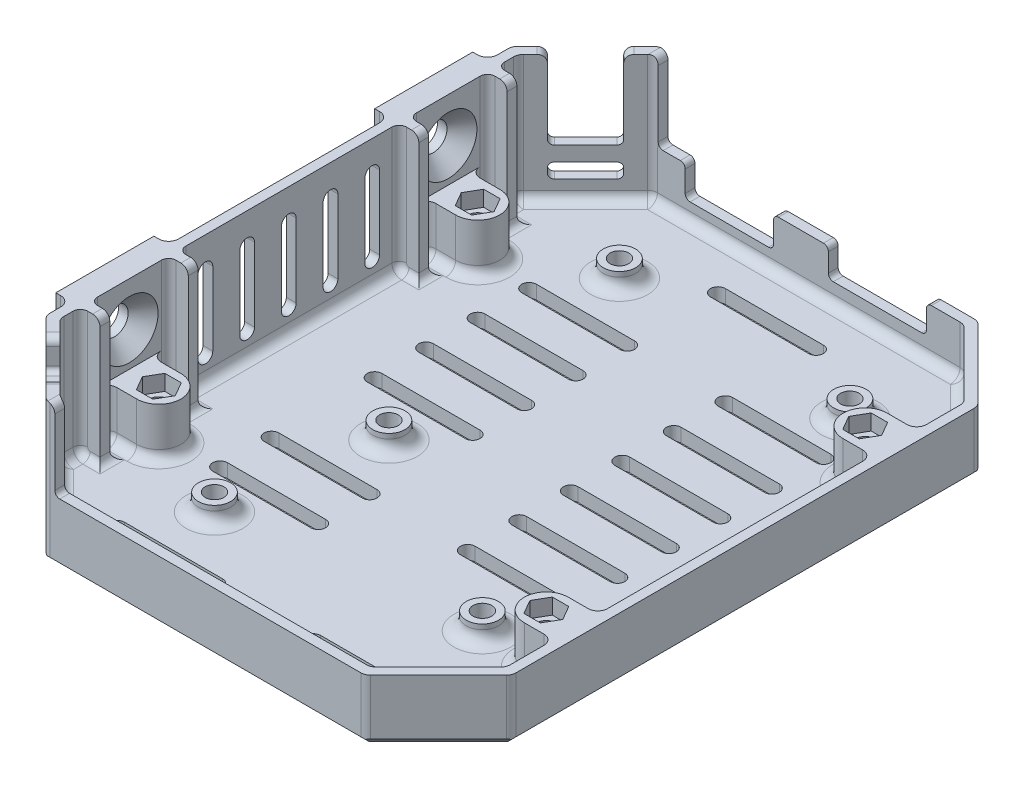
from build123d import *

# Parameters (mm, degrees)
SKICA1_W                                  = 95
SKICA1_H                                  = 125
P_IDAT_VYSUNUT_M1_DEPTH                   = 2.8
ZKOSEN_1_SIZE                             = 15
P_IDAT_VYSUNUT_M2_DEPTH                   = 10
SKICA3_R                                  = 1.9
ODEBRAT_VYSUNUT_M1_DEPTH                  = 10
ZKOSEN_2_SIZE                             = 1.5
ZAOBLIT1_R                                = 2
P_IDAT_START                              = 3.5
SKICA5_R                                  = 3.3
SKICA5_R_2                                = 1.9
P_IDAT_VYSUNUT_M3_DEPTH                   = 3.5
ZAOBLIT2_R                                = 2.5
ODEBRAT_VYSUNUT_M2_DEPTH                  = 2.8
SKICA7_W                                  = 23.5
SKICA7_H                                  = 20
SKICA7_R                                  = 3
P_IDAT_VYSUNUT_M4_DEPTH                   = 4.4
P_IDAT_VYSUNUT_M5_DEPTH                   = 16
SKICA9_W                                  = 24
SKICA9_H                                  = 20
SKICA9_R                                  = 3
P_IDAT_VYSUNUT_M6_DEPTH                   = 4
P_IDAT_VYSUNUT_M7_REACH                   = 161.623
SKICA10_W                                 = 6
SKICA10_H                                 = 2
ZAOBLIT4_R                                = 1.5
SKICA11_W                                 = 20
SKICA11_H                                 = 5.8
SKICA11_W_2                               = 18
SKICA11_H_2                               = 6.3
ODEBRAT_VYSUNUT_M3_DEPTH                  = 10
ZAOBLIT5_R                                = 1
ODEBRAT_VYSUNUT_M4_DEPTH                  = 10
ODEBRAT_VYSUNUT_M5_DEPTH                  = 3.5
SKICA14_W                                 = 11
SKICA14_H                                 = 32
SKICA14_H_2                               = 3
ODEBRAT_VYSUNUT_M6_DEPTH                  = 3.5
SKICA15_W                                 = 10
SKICA15_H                                 = 12
SKICA15_H_2                               = 3
ODEBRAT_VYSUNUT_M7_DEPTH                  = 3.5
ZAOBLIT6_R                                = 1
ZAOBLIT8_R                                = 1.5
ZAOBLIT9_R                                = 2
P_IDAT_VYSUNUT_M10_DEPTH                  = 10
ODEBRAT_VYSUNUT_M8_DEPTH                  = 3.2
SKICA25_W                                 = 20
SKICA25_H                                 = 20.4
P_IDAT_VYSUNUT_M13_DEPTH                  = 3
ZAOBLIT7_R                                = 2
ZAOBLIT13_R                               = 1
SKICA27_R                                 = 1.9
ODEBRAT_VYSUNUT_M11_DEPTH                 = 16
ZAOBLIT14_R                               = 2
ODEBRAT_VYSUNUT_M12_DEPTH                 = 101
KU_ELOV_ZAHLOUBEN_PRO_M5_ROUBY_SE_2_COUNT = 2
KU_ELOV_ZAHLOUBEN_PRO_M5_ROUBY_SE_2_PITCH = 65


# Some blends are built 0.0001 mm under size
with BuildPart() as part:
    # Skica1 → Přidat vysunutím1 (new body)
    with BuildSketch(Plane(origin=(0, 0, 0), x_dir=(1, 0, 0), z_dir=(0, 1, 0))):
        with Locations((47.5, 62.5)):
            Rectangle(SKICA1_W, SKICA1_H)
    extrude(amount=P_IDAT_VYSUNUT_M1_DEPTH)

    # Zkosení1
    zkosen_1_edges = [part.edges().sort_by_distance(p)[0] for p in [
        (0, 1.4, -125),
        (95, 1.4, -125),
        (95, 1.4, 0),
        (0, 1.4, 0),
    ]]
    chamfer(zkosen_1_edges, length=ZKOSEN_1_SIZE)

    # Skica2 → Přidat vysunutím2 (add)
    with BuildSketch(Plane(origin=(0, 2.8, 0), x_dir=(1, 0, 0), z_dir=(0, 1, 0))):
        Polygon((95, 15), (95, 110), (80, 125), (15, 125), (0, 110), (0, 15), (15, 0), (80, 0), align=None)
        Polygon((93, 15.828427125), (93, 109.171572875), (79.171572875, 123), (15.828427125, 123), (2, 109.171572875), (2, 15.828427125), (15.828427125, 2), (79.171572875, 2), align=None, mode=Mode.SUBTRACT)
    extrude(amount=P_IDAT_VYSUNUT_M2_DEPTH)

    # Skica3 → Odebrat vysunutím1 (cut)
    with BuildSketch(Plane(origin=(0, 2.8, 0), x_dir=(1, 0, 0), z_dir=(0, 1, 0))):
        with Locations(Location((25.87, 106.03, 0), (0, 0, 270))):
            Circle(SKICA3_R)
        with Locations(Location((74.13, 104.76, 0), (0, 0, 270))):
            Circle(SKICA3_R)
        with Locations(Location((74.13, 29.83, 0), (0, 0, 270))):
            Circle(SKICA3_R)
        with Locations(Location((30.95, 53.96, 0), (0, 0, 270))):
            Circle(SKICA3_R)
        with Locations(Location((25.87, 23.48, 0), (0, 0, 270))):
            Circle(SKICA3_R)
    extrude(amount=-ODEBRAT_VYSUNUT_M1_DEPTH, mode=Mode.SUBTRACT)

    # Zkosení2
    zkosen_2_edges = [part.edges().sort_by_distance(p)[0] for p in [
        (47.5, 0, -125),
        (0, 0, -62.5),
        (95, 0, -62.5),
        (47.5, 0, 0),
        (7.5, 0, -117.5),
        (7.5, 0, -7.5),
        (87.5, 0, -7.5),
        (87.5, 0, -117.5),
    ]]
    chamfer(zkosen_2_edges, length=ZKOSEN_2_SIZE)

    # Zaoblit1
    zaoblit1_edges = [part.edges().sort_by_distance(p)[0] for p in [
        (95, 7.15, -110),
        (80, 7.15, 0),
        (0, 7.15, -15),
        (15, 7.15, -125),
        (80, 7.15, -125),
        (95, 7.15, -15),
        (15, 7.15, 0),
        (0, 7.15, -110),
        (86.085786438, 2.8, -8.914213562),
        (93, 2.8, -62.5),
        (86.085786438, 2.8, -116.085786438),
        (47.5, 2.8, -123),
        (8.914213562, 2.8, -116.085786438),
        (2, 2.8, -62.5),
        (8.914213562, 2.8, -8.914213562),
        (47.5, 2.8, -2),
        (93, 7.8, -15.828427125),
        (93, 7.8, -109.171572875),
        (79.171572875, 7.8, -123),
        (15.828427125, 7.8, -123),
        (2, 7.8, -109.171572875),
        (2, 7.8, -15.828427125),
        (15.828427125, 7.8, -2),
        (79.171572875, 7.8, -2),
    ]]
    fillet(zaoblit1_edges, radius=ZAOBLIT1_R)

    # Skica5 → Přidat vysunutím3 (add)
    # profile 1 of 5: a face of its own
    with BuildSketch(Plane(origin=(0, 2.8, 0), x_dir=(1, 0, 0), z_dir=(0, 1, 0)).offset(P_IDAT_START)):
        with Locations(Location((74.13, 29.83, 0), (0, 0, 90))):
            Circle(SKICA5_R)
        with Locations(Location((74.13, 29.83, 0), (0, 0, 270))):
            Circle(SKICA5_R_2, mode=Mode.SUBTRACT)
    # profile 2 of 5: a face of its own
    with BuildSketch(Plane(origin=(0, 2.8, 0), x_dir=(1, 0, 0), z_dir=(0, 1, 0)).offset(P_IDAT_START)):
        with Locations(Location((25.87, 23.48, 0), (0, 0, 90))):
            Circle(SKICA5_R)
        with Locations(Location((25.87, 23.48, 0), (0, 0, 270))):
            Circle(SKICA5_R_2, mode=Mode.SUBTRACT)
    # profile 3 of 5: a face of its own
    with BuildSketch(Plane(origin=(0, 2.8, 0), x_dir=(1, 0, 0), z_dir=(0, 1, 0)).offset(P_IDAT_START)):
        with Locations(Location((30.95, 53.96, 0), (0, 0, 90))):
            Circle(SKICA5_R)
        with Locations(Location((30.95, 53.96, 0), (0, 0, 270))):
            Circle(SKICA5_R_2, mode=Mode.SUBTRACT)
    # profile 4 of 5: a face of its own
    with BuildSketch(Plane(origin=(0, 2.8, 0), x_dir=(1, 0, 0), z_dir=(0, 1, 0)).offset(P_IDAT_START)):
        with Locations(Location((25.87, 106.03, 0), (0, 0, 90))):
            Circle(SKICA5_R)
        with Locations(Location((25.87, 106.03, 0), (0, 0, 270))):
            Circle(SKICA5_R_2, mode=Mode.SUBTRACT)
    # profile 5 of 5: a face of its own
    with BuildSketch(Plane(origin=(0, 2.8, 0), x_dir=(1, 0, 0), z_dir=(0, 1, 0)).offset(P_IDAT_START)):
        with Locations(Location((74.13, 104.76, 0), (0, 0, 90))):
            Circle(SKICA5_R)
        with Locations(Location((74.13, 104.76, 0), (0, 0, 270))):
            Circle(SKICA5_R_2, mode=Mode.SUBTRACT)
    extrude(amount=-P_IDAT_VYSUNUT_M3_DEPTH)

    # Zaoblit2
    zaoblit2_edges = [part.edges().sort_by_distance(p)[0] for p in [
        (74.13, 2.8, -26.53),
        (25.87, 2.8, -20.18),
        (30.95, 2.8, -50.66),
        (25.87, 2.8, -102.73),
        (74.13, 2.8, -101.46),
    ]]
    fillet(zaoblit2_edges, radius=ZAOBLIT2_R)

    # Skica6 → Odebrat vysunutím2 (cut)
    with BuildSketch(Plane.XZ):
        Polygon((75.862050808, -107.76), (77.594101615, -104.76), (75.862050808, -101.76), (72.397949192, -101.76), (70.665898385, -104.76), (72.397949192, -107.76), align=None)
        Polygon((27.602050808, -109.03), (29.334101615, -106.03), (27.602050808, -103.03), (24.137949192, -103.03), (22.405898385, -106.03), (24.137949192, -109.03), align=None)
        Polygon((32.682050808, -56.96), (34.414101615, -53.96), (32.682050808, -50.96), (29.217949192, -50.96), (27.485898385, -53.96), (29.217949192, -56.96), align=None)
        Polygon((27.602050808, -26.48), (29.334101615, -23.48), (27.602050808, -20.48), (24.137949192, -20.48), (22.405898385, -23.48), (24.137949192, -26.48), align=None)
        Polygon((75.862050808, -32.83), (77.594101615, -29.83), (75.862050808, -26.83), (72.397949192, -26.83), (70.665898385, -29.83), (72.397949192, -32.83), align=None)
    extrude(amount=-ODEBRAT_VYSUNUT_M2_DEPTH, mode=Mode.SUBTRACT)

    # Skica7 → Přidat vysunutím4 (add)
    # profile 1 of 2: a face of its own
    with BuildSketch(Plane(origin=(0, 0, 0), x_dir=(-1, 0, 0), z_dir=(0, -1, 0))):
        with Locations((10.25, 95)):
            Rectangle(SKICA7_W, SKICA7_H)
        with Locations(Location((12, 95, 0), (0, 0, 90))):
            Circle(SKICA7_R, mode=Mode.SUBTRACT)
    # profile 2 of 2: a face of its own
    with BuildSketch(Plane(origin=(0, 0, 0), x_dir=(-1, 0, 0), z_dir=(0, -1, 0))):
        with Locations((10.25, 30)):
            Rectangle(SKICA7_W, SKICA7_H)
        with Locations(Location((12, 30, 0), (0, 0, 270))):
            Circle(SKICA7_R, mode=Mode.SUBTRACT)
    extrude(amount=-P_IDAT_VYSUNUT_M4_DEPTH)

    # Skica8 → Přidat vysunutím5 (add)
    with BuildSketch(Plane(origin=(0, 12.8, 0), x_dir=(1, 0, 0), z_dir=(0, 1, 0))):
        with BuildLine():
            Line((2, 108.343145751), (2, 16.656854249))
            ThreePointArc((2, 16.656854249), (2.152240935, 15.891487385), (2.585786438, 15.242640687))
            Line((2.585786438, 15.242640687), (15.242640687, 2.585786438))
            ThreePointArc((15.242640687, 2.585786438), (15.958145414, 2.126018687), (16.8, 2.005129254))
            Line((16.8, 2.005129254), (16.8, 0))
            Line((16.8, 0), (15.828427125, 0))
            ThreePointArc((15.828427125, 0), (15.06306026, 0.152240935), (14.414213562, 0.585786438))
            Line((14.414213562, 0.585786438), (0.585786438, 14.414213562))
            ThreePointArc((0.585786438, 14.414213562), (0.152240935, 15.06306026), (0, 15.828427125))
            Line((0, 15.828427125), (0, 109.171572875))
            ThreePointArc((0, 109.171572875), (0.152240935, 109.93693974), (0.585786438, 110.585786438))
            Line((0.585786438, 110.585786438), (14.414213562, 124.414213562))
            ThreePointArc((14.414213562, 124.414213562), (15.06306026, 124.847759065), (15.828427125, 125))
            Line((15.828427125, 125), (16.8, 125))
            Line((16.8, 125), (16.8, 123))
            Line((16.8, 123), (16.8, 122.994870746))
            ThreePointArc((16.8, 122.994870746), (15.958145414, 122.873981313), (15.242640687, 122.414213562))
            Line((15.242640687, 122.414213562), (2.585786438, 109.757359313))
            ThreePointArc((2.585786438, 109.757359313), (2.152240935, 109.108512615), (2, 108.343145751))
        make_face()
    extrude(amount=P_IDAT_VYSUNUT_M5_DEPTH)

    # Skica9 → Přidat vysunutím6 (add)
    # profile 1 of 2: a face of its own
    with BuildSketch(Plane(origin=(0, 24.8, 0), x_dir=(1, 0, 0), z_dir=(0, 1, 0))):
        with Locations((-10, 95)):
            Rectangle(SKICA9_W, SKICA9_H)
        with Locations(Location((-12, 95, 0), (0, 0, 90))):
            Circle(SKICA9_R, mode=Mode.SUBTRACT)
    # profile 2 of 2: a face of its own
    with BuildSketch(Plane(origin=(0, 24.8, 0), x_dir=(1, 0, 0), z_dir=(0, 1, 0))):
        with Locations((-10, 30)):
            Rectangle(SKICA9_W, SKICA9_H)
        with Locations(Location((-12, 30, 0), (0, 0, 270))):
            Circle(SKICA9_R, mode=Mode.SUBTRACT)
    extrude(amount=P_IDAT_VYSUNUT_M6_DEPTH)

    # Přidat vysunutím7: up to this face of the body (flat: up to its plane)
    p_idat_vysunut_m7_end = Plane(part.part.faces().sort_by_distance((47.574191913, 2.8, -62.437021826))[0])
    # Skica10 → Přidat vysunutím7 (add, up to the picked face)
    with BuildSketch(Plane(origin=(0, 28.8, 0), x_dir=(1, 0, 0), z_dir=(0, 1, 0)), mode=Mode.PRIVATE) as p_idat_vysunut_m7_sk1:
        with Locations((3, 104)):
            Rectangle(SKICA10_W, SKICA10_H)
    p_idat_vysunut_m7_tool1 = split(extrude(p_idat_vysunut_m7_sk1.sketch, amount=-P_IDAT_VYSUNUT_M7_REACH, mode=Mode.PRIVATE), bisect_by=p_idat_vysunut_m7_end, keep=Keep.BOTH, mode=Mode.PRIVATE)
    # Skica10 → Přidat vysunutím7 (add, up to the picked face)
    with BuildSketch(Plane(origin=(0, 28.8, 0), x_dir=(1, 0, 0), z_dir=(0, 1, 0)), mode=Mode.PRIVATE) as p_idat_vysunut_m7_sk2:
        with Locations((3, 86)):
            Rectangle(SKICA10_W, SKICA10_H)
    p_idat_vysunut_m7_tool2 = split(extrude(p_idat_vysunut_m7_sk2.sketch, amount=-P_IDAT_VYSUNUT_M7_REACH, mode=Mode.PRIVATE), bisect_by=p_idat_vysunut_m7_end, keep=Keep.BOTH, mode=Mode.PRIVATE)
    # Skica10 → Přidat vysunutím7 (add, up to the picked face)
    with BuildSketch(Plane(origin=(0, 28.8, 0), x_dir=(1, 0, 0), z_dir=(0, 1, 0)), mode=Mode.PRIVATE) as p_idat_vysunut_m7_sk3:
        with Locations((3, 39)):
            Rectangle(SKICA10_W, SKICA10_H)
    p_idat_vysunut_m7_tool3 = split(extrude(p_idat_vysunut_m7_sk3.sketch, amount=-P_IDAT_VYSUNUT_M7_REACH, mode=Mode.PRIVATE), bisect_by=p_idat_vysunut_m7_end, keep=Keep.BOTH, mode=Mode.PRIVATE)
    # Skica10 → Přidat vysunutím7 (add, up to the picked face)
    with BuildSketch(Plane(origin=(0, 28.8, 0), x_dir=(1, 0, 0), z_dir=(0, 1, 0)), mode=Mode.PRIVATE) as p_idat_vysunut_m7_sk4:
        with Locations((3, 21)):
            Rectangle(SKICA10_W, SKICA10_H)
    p_idat_vysunut_m7_tool4 = split(extrude(p_idat_vysunut_m7_sk4.sketch, amount=-P_IDAT_VYSUNUT_M7_REACH, mode=Mode.PRIVATE), bisect_by=p_idat_vysunut_m7_end, keep=Keep.BOTH, mode=Mode.PRIVATE)
    add(p_idat_vysunut_m7_tool1.solids().sort_by(Axis((3, 28.8, -104), (0, -1, 0)))[0])
    add(p_idat_vysunut_m7_tool2.solids().sort_by(Axis((3, 28.8, -86), (0, -1, 0)))[0])
    add(p_idat_vysunut_m7_tool3.solids().sort_by(Axis((3, 28.8, -39), (0, -1, 0)))[0])
    add(p_idat_vysunut_m7_tool4.solids().sort_by(Axis((3, 28.8, -21), (0, -1, 0)))[0])

    # Zaoblit4
    zaoblit4_edges = [part.edges().sort_by_distance(p)[0] for p in [
        (2.585786438, 3.385786438, -103),
        (2.585786438, 3.385786438, -105),
        (6, 28.8, -104),
        (2, 16.8, -103),
        (5, 2.8, -103),
        (6, 2.8, -104),
        (2, 16.8, -105),
        (5, 2.8, -105),
        (2.585786438, 3.385786438, -85),
        (2.585786438, 3.385786438, -87),
        (6, 28.8, -86),
        (2, 16.8, -85),
        (5, 2.8, -85),
        (6, 2.8, -86),
        (2, 16.8, -87),
        (5, 2.8, -87),
        (2.585786438, 3.385786438, -38),
        (2.585786438, 3.385786438, -40),
        (6, 28.8, -39),
        (2, 16.8, -38),
        (5, 2.8, -38),
        (6, 2.8, -39),
        (2, 16.8, -40),
        (5, 2.8, -40),
        (2.585786438, 3.385786438, -20),
        (2.585786438, 3.385786438, -22),
        (6, 28.8, -21),
        (2, 16.8, -20),
        (5, 2.8, -20),
        (6, 2.8, -21),
        (2, 16.8, -22),
        (5, 2.8, -22),
    ]]
    fillet(zaoblit4_edges, radius=ZAOBLIT4_R)

    # Skica11 → Odebrat vysunutím3 (cut)
    with BuildSketch(Plane(origin=(0, 0, -125), x_dir=(-1, 0, 0), z_dir=(0, 0, -1))):
        with Locations((-61.5, 9.9)):
            Rectangle(SKICA11_W, SKICA11_H)
        with Locations((-31.307, 9.65)):
            Rectangle(SKICA11_W_2, SKICA11_H_2)
    extrude(amount=-ODEBRAT_VYSUNUT_M3_DEPTH, mode=Mode.SUBTRACT)

    # Zaoblit5
    # the kernel refuses this fillet: 1 mm, written as the material it adds along each edge
    with BuildSketch(Plane(origin=(16.8, 12.8, -125), x_dir=(1, 0, 0), z_dir=(0, 0, 1)), Plane(origin=(16.8, 12.8, -2), x_dir=(1, 0, 0), z_dir=(0, 0, 1))) as zaoblit5_piece_1:
        with BuildLine():
            CenterArc((ZAOBLIT5_R, ZAOBLIT5_R), ZAOBLIT5_R, 180, 90)
            Line((0, ZAOBLIT5_R), (0, 0))
            Line((0, 0), (ZAOBLIT5_R, 0))
        make_face()
    extrude(amount=2)
    with BuildSketch(Plane(origin=(71.5, 7, -125), x_dir=(-1, 0, 0), z_dir=(0, 0, 1)), Plane(origin=(51.5, 7, -125), x_dir=(0, 1, 0), z_dir=(0, 0, 1)), Plane(origin=(40.307, 6.5, -125), x_dir=(-1, 0, 0), z_dir=(0, 0, 1)), Plane(origin=(22.307, 6.5, -125), x_dir=(0, 1, 0), z_dir=(0, 0, 1))) as zaoblit5_piece_2:
        with BuildLine():
            CenterArc((ZAOBLIT5_R, -ZAOBLIT5_R), ZAOBLIT5_R, 90, 90)
            Line((0, -ZAOBLIT5_R), (0, 0))
            Line((0, 0), (ZAOBLIT5_R, 0))
        make_face()
    extrude(amount=2)
    # the kernel refuses this fillet: 1 mm, written as the material it takes off along each edge
    with BuildSketch(Plane(origin=(71.5, 12.8, -127.5), x_dir=(0, -1, 0), z_dir=(0, 0, 1)), Plane(origin=(51.5, 12.8, -127.5), x_dir=(-1, 0, 0), z_dir=(0, 0, 1)), Plane(origin=(40.307, 12.8, -127.5), x_dir=(0, -1, 0), z_dir=(0, 0, 1)), Plane(origin=(22.307, 12.8, -127.5), x_dir=(-1, 0, 0), z_dir=(0, 0, 1))) as zaoblit5_2_piece_1:
        with BuildLine():
            CenterArc((ZAOBLIT5_R, ZAOBLIT5_R), ZAOBLIT5_R, 180, 90)
            Line((0, ZAOBLIT5_R), (0, 0))
            Line((0, 0), (ZAOBLIT5_R, 0))
        make_face()
    extrude(amount=7, mode=Mode.SUBTRACT)

    # Skica12 → Odebrat vysunutím4 (cut)
    with BuildSketch(Plane(origin=(0, 2.8, 0), x_dir=(1, 0, 0), z_dir=(0, 1, 0))):
        with BuildLine():
            Line((38.485786438, 115), (58.485786438, 115))
            ThreePointArc((58.485786438, 115), (59.985786438, 113.5), (58.485786438, 112))
            Line((58.485786438, 112), (38.485786438, 112))
            ThreePointArc((38.485786438, 112), (36.985786438, 113.5), (38.485786438, 115))
        make_face()
        with BuildLine():
            Line((18.485786438, 96.5), (38.485786438, 96.5))
            ThreePointArc((38.485786438, 96.5), (39.985786438, 95), (38.485786438, 93.5))
            Line((38.485786438, 93.5), (18.485786438, 93.5))
            ThreePointArc((18.485786438, 93.5), (16.985786438, 95), (18.485786438, 96.5))
        make_face()
        with BuildLine():
            Line((18.485786438, 86), (38.485786438, 86))
            ThreePointArc((38.485786438, 86), (39.985786438, 84.5), (38.485786438, 83))
            Line((38.485786438, 83), (18.485786438, 83))
            ThreePointArc((18.485786438, 83), (16.985786438, 84.5), (18.485786438, 86))
        make_face()
        with BuildLine():
            Line((18.485786438, 75.5), (38.485786438, 75.5))
            ThreePointArc((38.485786438, 75.5), (39.985786438, 74), (38.485786438, 72.5))
            Line((38.485786438, 72.5), (18.485786438, 72.5))
            ThreePointArc((18.485786438, 72.5), (16.985786438, 74), (18.485786438, 75.5))
        make_face()
        with BuildLine():
            Line((18.485786438, 65), (38.485786438, 65))
            ThreePointArc((38.485786438, 65), (39.985786438, 63.5), (38.485786438, 62))
            Line((38.485786438, 62), (18.485786438, 62))
            ThreePointArc((18.485786438, 62), (16.985786438, 63.5), (18.485786438, 65))
        make_face()
        with BuildLine():
            Line((78.485786438, 96.5), (58.485786438, 96.5))
            ThreePointArc((58.485786438, 96.5), (56.985786438, 95), (58.485786438, 93.5))
            Line((58.485786438, 93.5), (78.485786438, 93.5))
            ThreePointArc((78.485786438, 93.5), (79.985786438, 95), (78.485786438, 96.5))
        make_face()
        with BuildLine():
            Line((78.485786438, 86), (58.485786438, 86))
            ThreePointArc((58.485786438, 86), (56.985786438, 84.5), (58.485786438, 83))
            Line((58.485786438, 83), (78.485786438, 83))
            ThreePointArc((78.485786438, 83), (79.985786438, 84.5), (78.485786438, 86))
        make_face()
        with BuildLine():
            Line((78.485786438, 75.5), (58.485786438, 75.5))
            ThreePointArc((58.485786438, 75.5), (56.985786438, 74), (58.485786438, 72.5))
            Line((58.485786438, 72.5), (78.485786438, 72.5))
            ThreePointArc((78.485786438, 72.5), (79.985786438, 74), (78.485786438, 75.5))
        make_face()
        with BuildLine():
            Line((78.485786438, 65), (58.485786438, 65))
            ThreePointArc((58.485786438, 65), (56.985786438, 63.5), (58.485786438, 62))
            Line((58.485786438, 62), (78.485786438, 62))
            ThreePointArc((78.485786438, 62), (79.985786438, 63.5), (78.485786438, 65))
        make_face()
        with BuildLine():
            Line((18.485786438, 44), (38.485786438, 44))
            ThreePointArc((38.485786438, 44), (39.985786438, 42.5), (38.485786438, 41))
            Line((38.485786438, 41), (18.485786438, 41))
            ThreePointArc((18.485786438, 41), (16.985786438, 42.5), (18.485786438, 44))
        make_face()
        with BuildLine():
            Line((18.485786438, 33.5), (38.485786438, 33.5))
            ThreePointArc((38.485786438, 33.5), (39.985786438, 32), (38.485786438, 30.5))
            Line((38.485786438, 30.5), (18.485786438, 30.5))
            ThreePointArc((18.485786438, 30.5), (16.985786438, 32), (18.485786438, 33.5))
        make_face()
        with BuildLine():
            Line((18.485786438, 12.5), (38.485786438, 12.5))
            ThreePointArc((38.485786438, 12.5), (39.985786438, 11), (38.485786438, 9.5))
            Line((38.485786438, 9.5), (18.485786438, 9.5))
            ThreePointArc((18.485786438, 9.5), (16.985786438, 11), (18.485786438, 12.5))
        make_face()
        with BuildLine():
            Line((78.485786438, 54.5), (58.485786438, 54.5))
            ThreePointArc((58.485786438, 54.5), (56.985786438, 53), (58.485786438, 51.5))
            Line((58.485786438, 51.5), (78.485786438, 51.5))
            ThreePointArc((78.485786438, 51.5), (79.985786438, 53), (78.485786438, 54.5))
        make_face()
        with BuildLine():
            Line((78.485786438, 44), (58.485786438, 44))
            ThreePointArc((58.485786438, 44), (56.985786438, 42.5), (58.485786438, 41))
            Line((58.485786438, 41), (78.485786438, 41))
            ThreePointArc((78.485786438, 41), (79.985786438, 42.5), (78.485786438, 44))
        make_face()
        with BuildLine():
            Line((78.485786438, 12.5), (58.485786438, 12.5))
            ThreePointArc((58.485786438, 12.5), (56.985786438, 11), (58.485786438, 9.5))
            Line((58.485786438, 9.5), (78.485786438, 9.5))
            ThreePointArc((78.485786438, 9.5), (79.985786438, 11), (78.485786438, 12.5))
        make_face()
    extrude(amount=-ODEBRAT_VYSUNUT_M4_DEPTH, mode=Mode.SUBTRACT)

    # Skica13 → Odebrat vysunutím5 (cut)
    with BuildSketch(Plane.ZY):
        with BuildLine():
            Line((-78, 22.5), (-78, 7.5))
            ThreePointArc((-78, 7.5), (-79.5, 6), (-81, 7.5))
            Line((-81, 7.5), (-81, 22.5))
            ThreePointArc((-81, 22.5), (-79.5, 24), (-78, 22.5))
        make_face()
        with BuildLine():
            Line((-69.5, 22.5), (-69.5, 7.5))
            ThreePointArc((-69.5, 7.5), (-71, 6), (-72.5, 7.5))
            Line((-72.5, 7.5), (-72.5, 22.5))
            ThreePointArc((-72.5, 22.5), (-71, 24), (-69.5, 22.5))
        make_face()
        with BuildLine():
            Line((-61, 22.5), (-61, 7.5))
            ThreePointArc((-61, 7.5), (-62.5, 6), (-64, 7.5))
            Line((-64, 7.5), (-64, 22.5))
            ThreePointArc((-64, 22.5), (-62.5, 24), (-61, 22.5))
        make_face()
        with BuildLine():
            Line((-52.5, 22.5), (-52.5, 7.5))
            ThreePointArc((-52.5, 7.5), (-54, 6), (-55.5, 7.5))
            Line((-55.5, 7.5), (-55.5, 22.5))
            ThreePointArc((-55.5, 22.5), (-54, 24), (-52.5, 22.5))
        make_face()
        with BuildLine():
            Line((-44, 22.5), (-44, 7.5))
            ThreePointArc((-44, 7.5), (-45.5, 6), (-47, 7.5))
            Line((-47, 7.5), (-47, 22.5))
            ThreePointArc((-47, 22.5), (-45.5, 24), (-44, 22.5))
        make_face()
    extrude(amount=-ODEBRAT_VYSUNUT_M5_DEPTH, mode=Mode.SUBTRACT)

    # Skica14 → Odebrat vysunutím6 (cut)
    with BuildSketch(Plane(origin=(-55, 0, -55), x_dir=(-0.7071067811865488, 0, 0.7071067811865464), z_dir=(-0.7071067811865464, 0, -0.7071067811865488))):
        with Locations((-88.388347648, 28.8)):
            Rectangle(SKICA14_W, SKICA14_H)
        with Locations((-88.388347648, 8.3)):
            Rectangle(SKICA14_W, SKICA14_H_2)
    extrude(amount=-ODEBRAT_VYSUNUT_M6_DEPTH, mode=Mode.SUBTRACT)

    # Skica15 → Odebrat vysunutím7 (cut)
    with BuildSketch(Plane(origin=(7.5, 0, -7.5), x_dir=(0.7071067811865464, 0, 0.7071067811865488), z_dir=(-0.7071067811865488, 0, 0.7071067811865464))):
        with Locations((0, 28.8)):
            Rectangle(SKICA15_W, SKICA15_H)
        with Locations((0, 15.3)):
            Rectangle(SKICA15_W, SKICA15_H_2)
    extrude(amount=-ODEBRAT_VYSUNUT_M7_DEPTH, mode=Mode.SUBTRACT)

    # Zaoblit6
    zaoblit6_edges = [part.edges().sort_by_distance(p)[0] for p in [
        (4.318019485, 12.8, -112.903805922),
        (12.096194078, 12.8, -120.681980515),
        (4.318019485, 9.8, -112.903805922),
        (4.318019485, 6.8, -112.903805922),
        (12.096194078, 6.8, -120.681980515),
        (12.096194078, 9.8, -120.681980515),
        (4.671572875, 22.8, -11.742640687),
        (11.742640687, 22.8, -4.671572875),
        (11.742640687, 16.8, -4.671572875),
        (11.742640687, 13.8, -4.671572875),
        (4.671572875, 13.8, -11.742640687),
        (4.671572875, 16.8, -11.742640687),
    ]]
    fillet(zaoblit6_edges, radius=ZAOBLIT6_R)

    # Zaoblit8
    # the kernel refuses this fillet: 1.5 mm, written as the material it takes off along each edge
    with BuildSketch(Plane(origin=(8.737436867, 28.8, -124.040737726), x_dir=(0, -1, 0), z_dir=(0.7071067811865464, 0, 0.7071067811865488)), Plane(origin=(7.676776695, 28.8, -109.545048712), x_dir=(0, -1, 0), z_dir=(-0.7071067811865464, 0, -0.7071067811865488)), Plane(origin=(15.101397898, 28.8, -8.030330086), x_dir=(0, -1, 0), z_dir=(-0.7071067811865488, 0, 0.7071067811865464))) as zaoblit8_piece_1:
        with BuildLine():
            CenterArc((ZAOBLIT8_R, ZAOBLIT8_R), ZAOBLIT8_R, 180, 90)
            Line((0, ZAOBLIT8_R), (0, 0))
            Line((0, 0), (ZAOBLIT8_R, 0))
        make_face()
    extrude(amount=9.5, mode=Mode.SUBTRACT)
    with BuildSketch(Plane(origin=(1.312815665, 28.8, -8.383883476), x_dir=(-0.7071067811865464, 0, -0.7071067811865487), z_dir=(0.7071067811865488, 0, -0.7071067811865464))) as zaoblit8_piece_2:
        with BuildLine():
            CenterArc((ZAOBLIT8_R, -ZAOBLIT8_R), ZAOBLIT8_R, 90, 90)
            Line((0, -ZAOBLIT8_R), (0, 0))
            Line((0, 0), (ZAOBLIT8_R, 0))
        make_face()
    extrude(amount=9.5, mode=Mode.SUBTRACT)
    with BuildSketch(Plane(origin=(16.8, 28.8, -128.75), x_dir=(-1, 0, 0), z_dir=(0, 0, 1))) as zaoblit8_piece_3:
        with BuildLine():
            CenterArc((ZAOBLIT8_R, ZAOBLIT8_R), ZAOBLIT8_R, 180, 90)
            Line((0, ZAOBLIT8_R), (0, 0))
            Line((0, 0), (ZAOBLIT8_R, 0))
        make_face()
    extrude(amount=5.75, mode=Mode.SUBTRACT)
    with BuildSketch(Plane(origin=(16.8, 28.8, -5.755129254), x_dir=(-1, 0, 0), z_dir=(0, 0, 1))) as zaoblit8_piece_4:
        with BuildLine():
            CenterArc((ZAOBLIT8_R, ZAOBLIT8_R), ZAOBLIT8_R, 180, 90)
            Line((0, ZAOBLIT8_R), (0, 0))
            Line((0, 0), (ZAOBLIT8_R, 0))
        make_face()
    extrude(amount=9.505129254, mode=Mode.SUBTRACT)
    with BuildSketch(Plane(origin=(16.8, 28.8, -123), x_dir=(-1.0, 0, -2.0779125944772392e-12), z_dir=(-2.0779125944772392e-12, 0, 1.0))) as zaoblit8_piece_5:
        with BuildLine():
            CenterArc((ZAOBLIT8_R, ZAOBLIT8_R), ZAOBLIT8_R, 180, 90)
            Line((0, ZAOBLIT8_R), (0, 0))
            Line((0, 0), (ZAOBLIT8_R, 0))
        make_face()
    extrude(amount=6.380129254, mode=Mode.SUBTRACT)

    # Zaoblit9
    zaoblit9_edges = [part.edges().sort_by_distance(p)[0] for p in [
        (-22, 2.2, -85),
        (-22, 2.2, -105),
        (-22, 2.2, -20),
        (-22, 2.2, -40),
        (-22, 26.8, -85),
        (-22, 26.8, -105),
        (-22, 26.8, -20),
        (-22, 26.8, -40),
    ]]
    fillet(zaoblit9_edges, radius=ZAOBLIT9_R)

    # Skica20 → Přidat vysunutím10 (add)
    with BuildSketch(Plane(origin=(0, 2.8, 0), x_dir=(1, 0, 0), z_dir=(0, 1, 0))):
        with BuildLine():
            Line((8, 34.5), (2, 34.5))
            Line((2, 34.5), (2, 25.5))
            Line((2, 25.5), (8, 25.5))
            ThreePointArc((8, 25.5), (12.5, 30), (8, 34.5))
        make_face()
        with BuildLine():
            Line((8, 99.5), (2, 99.5))
            Line((2, 99.5), (2, 90.5))
            Line((2, 90.5), (8, 90.5))
            ThreePointArc((8, 90.5), (12.5, 95), (8, 99.5))
        make_face()
    p_idat_vysunut_m10 = extrude(amount=P_IDAT_VYSUNUT_M10_DEPTH)

    # Skica21 → Odebrat vysunutím8 (cut)
    with BuildSketch(Plane(origin=(0, 12.8, 0), x_dir=(1, 0, 0), z_dir=(0, 1, 0))):
        Polygon((11.348631561, 95), (9.674315781, 97.9), (6.325684219, 97.9), (4.651368439, 95), (6.325684219, 92.1), (9.674315781, 92.1), align=None)
        Polygon((11.348631561, 30), (9.674315781, 32.9), (6.325684219, 32.9), (4.651368439, 30), (6.325684219, 27.1), (9.674315781, 27.1), align=None)
    odebrat_vysunut_m8 = extrude(amount=-ODEBRAT_VYSUNUT_M8_DEPTH, mode=Mode.SUBTRACT)

    # Zrcadlit2: Přidat vysunutím10, Odebrat vysunutím8 across plane
    add(p_idat_vysunut_m10.mirror(Plane(origin=(47.5, 0, 0), x_dir=(0, 0, 1), z_dir=(1, 0, 0))))
    add(odebrat_vysunut_m8.mirror(Plane(origin=(47.5, 0, 0), x_dir=(0, 0, 1), z_dir=(1, 0, 0))), mode=Mode.SUBTRACT)

    # Skica25 → Přidat vysunutím13 (add)
    with BuildSketch(Plane.ZY):
        with Locations((-95, 14.6)):
            Rectangle(SKICA25_W, SKICA25_H)
        with Locations((-30, 14.6)):
            Rectangle(SKICA25_W, SKICA25_H)
    extrude(amount=P_IDAT_VYSUNUT_M13_DEPTH)

    # Zaoblit7
    zaoblit7_edges = [part.edges().sort_by_distance(p)[0] for p in [
        (0, 15.15, -105),
        (0, 15.15, -85),
        (0, 15.15, -20),
        (0, 15.15, -40),
    ]]
    fillet(zaoblit7_edges, radius=ZAOBLIT7_R)

    # Zaoblit13
    zaoblit13_edges = [part.edges().sort_by_distance(p)[0] for p in [
        (-3, 4.4, -95),
        (-3, 24.8, -95),
        (-3, 4.4, -30),
        (-3, 24.8, -30),
    ]]
    fillet(zaoblit13_edges, radius=ZAOBLIT13_R)

    # Skica27 → Odebrat vysunutím11 (cut)
    with BuildSketch(Plane(origin=(0, 9.6, 0), x_dir=(1, 0, 0), z_dir=(0, 1, 0))):
        with Locations(Location((8, 95, 0), (0, 0, 270))):
            Circle(SKICA27_R)
        with Locations(Location((8, 30, 0), (0, 0, 270))):
            Circle(SKICA27_R)
        with Locations(Location((87, 95, 0), (0, 0, 270))):
            Circle(SKICA27_R)
        with Locations(Location((87, 30, 0), (0, 0, 270))):
            Circle(SKICA27_R)
    extrude(amount=-ODEBRAT_VYSUNUT_M11_DEPTH, mode=Mode.SUBTRACT)

    # Zaoblit14
    zaoblit14_edges = [part.edges().sort_by_distance(p)[0] for p in [
        (2, 8.8, -25.5),
        (2.585786438, 3.385786438, -25.5),
        (6, 2.8, -25.5),
        (2, 8.8, -34.5),
        (2.585786438, 3.385786438, -34.5),
        (6, 2.8, -34.5),
        (2, 8.8, -90.5),
        (2.585786438, 3.385786438, -90.5),
        (6, 2.8, -90.5),
        (2, 8.8, -99.5),
        (2.585786438, 3.385786438, -99.5),
        (6, 2.8, -99.5),
        (93, 8.8, -90.5),
        (92.414213562, 3.385786438, -90.5),
        (89, 2.8, -90.5),
        (82.5, 2.8, -95),
        (93, 8.8, -99.5),
        (92.414213562, 3.385786438, -99.5),
        (93, 8.8, -25.5),
        (92.414213562, 3.385786438, -25.5),
        (89, 2.8, -25.5),
        (82.5, 2.8, -30),
        (93, 8.8, -34.5),
        (92.414213562, 3.385786438, -34.5),
        (12.5, 2.8, -30),
        (12.5, 2.8, -95),
        (89, 2.8, -99.5),
        (89, 2.8, -34.5),
    ]]
    fillet(zaoblit14_edges, radius=ZAOBLIT14_R - 0.0001)  # a hair under: the kernel refuses the full size

    # Skica28 → Odebrat vysunutím12 (cut)
    with BuildSketch(Plane.XY.offset(-20)):
        Polygon((-22, 28.8), (-22, 0), (1.5, 0), (-3, 4.5), (-3, 28.8), align=None)
    extrude(amount=-ODEBRAT_VYSUNUT_M12_DEPTH, mode=Mode.SUBTRACT)

    # Skica31 → Kuželové zahloubení pro M5 šrouby se zápustnou hlavou s vnitřním šestihranem1 (revolve, cut)
    with BuildSketch(Plane(origin=(2, 19.8, -30), x_dir=(0, 0, -1), z_dir=(0, 1, 0))):
        Polygon((0, 0), (0, 5), (2.8, 5), (2.8, 3.05), (5.85, 0), align=None)
    ku_elov_zahlouben_pro_m5_rouby_se_z_p = revolve(axis=Axis((8.35, 19.8, -30), (-1, 0, 0)), mode=Mode.SUBTRACT)

    # Ku_elov_ zahlouben_ pro M5 _rouby se 2: Kuželové zahloubení pro M5 šrouby se zápustnou hlavou s vnitřním šestihranem1 ×2
    with Locations(*[(0, 0, -i * KU_ELOV_ZAHLOUBEN_PRO_M5_ROUBY_SE_2_PITCH) for i in range(1, KU_ELOV_ZAHLOUBEN_PRO_M5_ROUBY_SE_2_COUNT)]):
        add(ku_elov_zahlouben_pro_m5_rouby_se_z_p, mode=Mode.SUBTRACT)


solid = part.part
